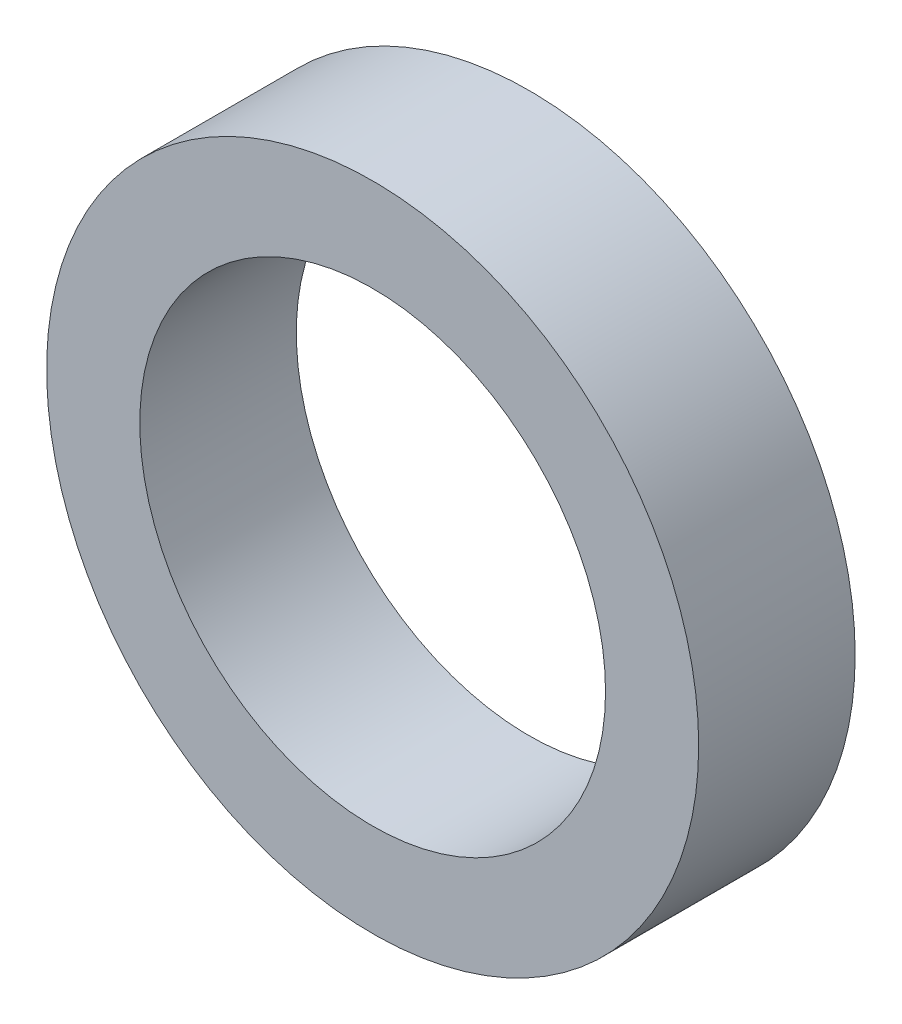
from build123d import *

# Parameters (mm, degrees)
SKETCH1_R           = 11.1125
SKETCH1_R_2         = 7.9375
BOSS_EXTRUDE1_DEPTH = 5.334


with BuildPart() as part:
    # Sketch1 → Boss-Extrude1 (new body)
    with BuildSketch(Plane(origin=(0, 0, 0), x_dir=(0, 1, 0), z_dir=(0, 0, 1))):
        Circle(SKETCH1_R)
        Circle(SKETCH1_R_2, mode=Mode.SUBTRACT)
    extrude(amount=BOSS_EXTRUDE1_DEPTH)


solid = part.part
